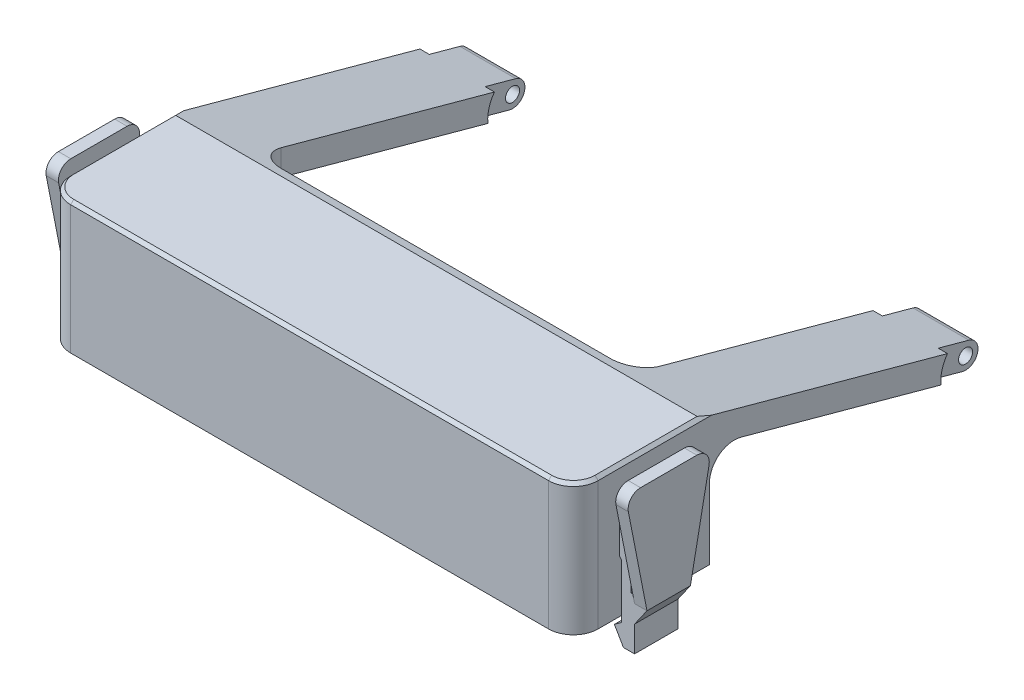
from build123d import *

# Parameters (mm, degrees)
BOSS_EXTRUDE6_DEPTH            = 42.5
FILLET3_R                      = 4
BOSS_EXTRUDE7_DEPTH            = 19.200000225
SKETCH16_W                     = 12
SKETCH16_H                     = 56.251708931
BOSS_EXTRUDE8_DEPTH            = 21.200000225
MIRROR10_START                 = -2.25e-07
MIRROR10_DEPTH                 = 21.200000225
MIRROR10_START_2               = 19.2
MIRROR10_2_DEPTH               = 2
SKETCH17_R                     = 1.132230372
CUT_EXTRUDE3_DEPTH             = 109.502203117
CHAMFER1_SIZE                  = 0.5
SKETCH18_R                     = 5.5
CUT_EXTRUDE4_DEPTH             = 1.5
MIRROR12_COPY_1_SKETCH_R       = 5.5
MIRROR12_COPY_1_DEPTH          = 1.5
CUT_EXTRUDE7_REACH             = 100.98
CUT_EXTRUDE7_DIRECTION_2_REACH = 100.98
FILLET4_R                      = 4
SKETCH41_W                     = 5
SKETCH41_H                     = 0.8
BOSS_EXTRUDE20_DEPTH           = 0.6
BOSS_EXTRUDE21_DEPTH           = 3.5
BOSS_EXTRUDE23_DEPTH           = 2
FILLET5_R                      = 0.3
FILLET6_R                      = 0.1


# Read off the part's stored shape, not the designer's step: Mirror10
with BuildPart() as part:
    # Sketch14 → Boss-Extrude6 (new body)
    with BuildSketch(Plane(origin=(0, 0, 0), x_dir=(0, 0, -1), z_dir=(1, 0, 0))):
        Polygon((-7.766164208, -2.25e-07), (-10.966164208, -2.25e-07), (-10.966164208, 21.2), (10.966164208, 21.2), (10.966164208, -2.25e-07), (7.766164208, -2.25e-07), (7.766164208, 19.2), (-7.766164208, 19.2), align=None)
    extrude(amount=BOSS_EXTRUDE6_DEPTH)

    # Fillet3
    fillet3_edges = [part.edges().sort_by_distance(p)[0] for p in [
        (42.5, 10.599999888, 10.966164208),
    ]]
    fillet(fillet3_edges, radius=FILLET3_R)

    # Sketch15 → Boss-Extrude7 (add)
    with BuildSketch(Plane.XZ.offset(-19.2)):
        with BuildLine():
            Line((42.5, 6.966164208), (42.5, -7.766164208))
            Line((42.5, -7.766164208), (40, -7.766164208))
            Line((40, -7.766164208), (40, 6.966164208))
            ThreePointArc((40, 6.966164208), (39.99240423, 7.116927651), (39.969693846, 7.266164208))
            ThreePointArc((39.969693846, 7.266164208), (39.448683298, 8.128059212), (38.5, 8.466164208))
            Line((38.5, 8.466164208), (38.5, 10.966164208))
            ThreePointArc((38.5, 10.966164208), (41.029822128, 10.064550885), (42.419183588, 7.766164208))
            ThreePointArc((42.419183588, 7.766164208), (42.479744612, 7.368200056), (42.5, 6.966164208))
        make_face()
    extrude(amount=BOSS_EXTRUDE7_DEPTH)

    # Sketch16 → Boss-Extrude8 (add)
    with BuildSketch(Plane(origin=(0, 21.2, 0), x_dir=(1, 0, 0), z_dir=(0, 1, 0))):
        with Locations((36.5, 35.892018674)):
            Rectangle(SKETCH16_W, SKETCH16_H)
    extrude(amount=-BOSS_EXTRUDE8_DEPTH)

    # Mirror10 outline → Mirror10 (add)
    with BuildSketch(Plane(origin=(0, 0, 0), x_dir=(1, 0, 0), z_dir=(0, 1, 0)).offset(MIRROR10_START)):
        with BuildLine():
            Line((0, -7.766164208), (-39.768857754, -7.766164208))
            ThreePointArc((-39.768857754, -7.766164208), (-39.941056319, -7.382525451), (-40, -6.966164208))
            Line((-40, -6.966164208), (-40, 7.766164208))
            Line((-40, 7.766164208), (0, 7.766164208))
            Line((0, 7.766164208), (0, 10.966164208))
            Line((0, 10.966164208), (-30.5, 10.966164208))
            Line((-30.5, 10.966164208), (-30.5, 64.017873139))
            Line((-30.5, 64.017873139), (-42.5, 64.017873139))
            Line((-42.5, 64.017873139), (-42.5, -6.966164208))
            ThreePointArc((-42.5, -6.966164208), (-41.328427125, -9.794591333), (-38.5, -10.966164208))
            Line((-38.5, -10.966164208), (0, -10.966164208))
            Line((0, -10.966164208), (0, -7.766164208))
        make_face()
    extrude(amount=MIRROR10_DEPTH)

    # Mirror10 2 outline → Mirror10 2 (add)
    with BuildSketch(Plane(origin=(0, 0, 0), x_dir=(1, 0, 0), z_dir=(0, 1, 0)).offset(MIRROR10_START_2)):
        with BuildLine():
            ThreePointArc((-40, -6.966164208), (-39.941056319, -7.382525451), (-39.768857754, -7.766164208))
            Line((-39.768857754, -7.766164208), (0, -7.766164208))
            Line((0, -7.766164208), (0, 7.766164208))
            Line((0, 7.766164208), (-40, 7.766164208))
            Line((-40, 7.766164208), (-40, -6.966164208))
        make_face()
    extrude(amount=MIRROR10_2_DEPTH)

    # Sketch17 → Cut-Extrude3 (cut, through all)
    with BuildSketch(Plane.ZY.offset(42.5)):
        with Locations((-53.736263186, 6.999999775)):
            Circle(SKETCH17_R)
        with BuildLine():
            Line((-9.466164208, 21.2), (-54.264633471, 8.928943746))
            ThreePointArc((-54.264633471, 8.928943746), (-55.665207156, 6.47162949), (-53.207892901, 5.071055805))
            Line((-53.207892901, 5.071055805), (-16.022904778, 15.256651174))
            ThreePointArc((-16.022904778, 15.256651174), (-12.539949284, 14.578933218), (-10.966164208, 11.398763232))
            Line((-10.966164208, 11.398763232), (-10.966164208, -2.25e-07))
            Line((-10.966164208, -2.25e-07), (-58.949878023, -2.25e-07))
            Line((-58.949878023, -2.25e-07), (-64.017873139, -2.25e-07))
            Line((-64.017873139, -2.25e-07), (-64.017873139, 6.372862294))
            Line((-64.017873139, 6.372862294), (-64.017873139, 21.2))
            Line((-64.017873139, 21.2), (-9.466164208, 21.2))
        make_face()
    extrude(amount=-CUT_EXTRUDE3_DEPTH, mode=Mode.SUBTRACT)

    # Chamfer1
    chamfer1_edges = [part.edges().sort_by_distance(p)[0] for p in [
        (-42.5, 21.2, -1.25),
        (42.5, 21.2, -1.25),
        (19.25, 21.2, 10.966164208),
        (41.328427125, 21.2, 9.794591333),
        (-41.328427125, 21.2, 9.794591333),
    ]]
    chamfer(chamfer1_edges, length=CHAMFER1_SIZE)

    # Sketch18 → Cut-Extrude4 (cut)
    with BuildSketch(Plane.ZY.offset(42.5)):
        with Locations((-53.736263186, 6.999999775)):
            Circle(SKETCH18_R)
    cut_extrude4 = extrude(amount=-CUT_EXTRUDE4_DEPTH, mode=Mode.SUBTRACT)

    # Mirror11: Cut-Extrude4 across plane
    add(cut_extrude4.mirror(Plane.ZY.offset(36.5)), mode=Mode.SUBTRACT)

    # Mirror12: Cut-Extrude4 across plane
    add(cut_extrude4.mirror(Plane(origin=(0, 0, 0), x_dir=(0, 0, 1), z_dir=(1, 0, 0))), mode=Mode.SUBTRACT)

    # Mirror12 copy 1 sketch → Mirror12 copy 1 (cut)
    with BuildSketch(Plane.ZY.offset(-30.5)):
        with Locations((-53.736263186, 6.999999775)):
            Circle(MIRROR12_COPY_1_SKETCH_R)
    extrude(amount=-MIRROR12_COPY_1_DEPTH, mode=Mode.SUBTRACT)

    # Cut-Extrude7: up to this face of the body (flat: up to its plane)
    cut_extrude7_end = Plane(part.part.faces().sort_by_distance((-40, 9.599999887, -0.4))[0])
    # Sketch23 → Cut-Extrude7 (cut, up to the picked face)
    with BuildSketch(Plane.ZY.offset(36.5), mode=Mode.PRIVATE) as cut_extrude7_sk1:
        with BuildLine():
            Line((-16.287089921, 16.221123159), (-45.347315212, 8.261037353))
            ThreePointArc((-45.347315212, 8.261037353), (-45.878172566, 7.903119099), (-46.083130069, 7.296565368))
            Line((-46.083130069, 7.296565368), (-46.083130069, 7.022648503))
            Line((-46.083130069, 7.022648503), (-47.68348017, 6.584285621))
            Line((-47.68348017, 6.584285621), (-47.68348017, 7.406036215))
            ThreePointArc((-47.68348017, 7.406036215), (-47.068607659, 9.225697409), (-45.476035597, 10.299452171))
            Line((-45.476035597, 10.299452171), (-11.027350425, 19.735528015))
            Line((-11.027350425, 19.735528015), (-7.766164208, 19.2))
            Line((-7.766164208, 19.2), (-7.766164208, 13.2))
            Line((-7.766164208, 13.2), (-10.301880115, 13.2))
            ThreePointArc((-10.301880115, 13.2), (-12.713097942, 15.862359585), (-16.287089921, 16.221123159))
        make_face()
    cut_extrude7_tool1 = split(extrude(cut_extrude7_sk1.sketch, amount=CUT_EXTRUDE7_REACH, mode=Mode.PRIVATE), bisect_by=cut_extrude7_end, keep=Keep.BOTH, mode=Mode.PRIVATE)
    add(cut_extrude7_tool1.solids().sort_by(Axis((-36.5, 14.283351, -24.707146), (-1, 0, 0)))[0], mode=Mode.SUBTRACT)

    # Cut-Extrude7 direction 2: up to this face of the body (flat: up to its plane)
    cut_extrude7_direction_2_end = Plane(part.part.faces().sort_by_distance((-32, 7.583720498, -51.605249006))[0])
    # Sketch23 → Cut-Extrude7 direction 2 (cut, up to the picked face)
    with BuildSketch(Plane.ZY.offset(36.5), mode=Mode.PRIVATE) as cut_extrude7_direction_2_sk1:
        with BuildLine():
            Line((-16.287089921, 16.221123159), (-45.347315212, 8.261037353))
            ThreePointArc((-45.347315212, 8.261037353), (-45.878172566, 7.903119099), (-46.083130069, 7.296565368))
            Line((-46.083130069, 7.296565368), (-46.083130069, 7.022648503))
            Line((-46.083130069, 7.022648503), (-47.68348017, 6.584285621))
            Line((-47.68348017, 6.584285621), (-47.68348017, 7.406036215))
            ThreePointArc((-47.68348017, 7.406036215), (-47.068607659, 9.225697409), (-45.476035597, 10.299452171))
            Line((-45.476035597, 10.299452171), (-11.027350425, 19.735528015))
            Line((-11.027350425, 19.735528015), (-7.766164208, 19.2))
            Line((-7.766164208, 19.2), (-7.766164208, 13.2))
            Line((-7.766164208, 13.2), (-10.301880115, 13.2))
            ThreePointArc((-10.301880115, 13.2), (-12.713097942, 15.862359585), (-16.287089921, 16.221123159))
        make_face()
    cut_extrude7_direction_2_tool1 = split(extrude(cut_extrude7_direction_2_sk1.sketch, amount=-CUT_EXTRUDE7_DIRECTION_2_REACH, mode=Mode.PRIVATE), bisect_by=cut_extrude7_direction_2_end, keep=Keep.BOTH, mode=Mode.PRIVATE)
    add(cut_extrude7_direction_2_tool1.solids().sort_by(Axis((-36.5, 14.283351, -24.707146), (1, 0, 0)))[0], mode=Mode.SUBTRACT)

    # Fillet4
    fillet4_edges = [part.edges().sort_by_distance(p)[0] for p in [
        (-30.5, 16.093943968, -10.966164208),
        (30.5, 16.093943967, -10.966164208),
    ]]
    fillet(fillet4_edges, radius=FILLET4_R)

    # Sketch41 → Boss-Extrude20 (add)
    with BuildSketch(Plane.XZ):
        Polygon((-40, -5.266164208), (-35, -6.966164208), (-35, -7.766164208), (-40, -7.766164208), align=None)
        Polygon((35, -6.966164208), (35, -7.766164208), (40, -7.766164208), (40, -5.266164208), align=None)
        with Locations((-37.5, 7.366164208)):
            Rectangle(SKETCH41_W, SKETCH41_H)
        with Locations((37.5, 7.366164208)):
            Rectangle(SKETCH41_W, SKETCH41_H)
    extrude(amount=-BOSS_EXTRUDE20_DEPTH)

    # Sketch42 → Boss-Extrude21 (add, symmetric)
    with BuildSketch(Plane.XY):
        Polygon((-44.9, 0.143703762), (-44.9, -4.017561374), (-43.1, -4.017561374), (-41.65, -1.517561374), (-42.8, -0.682037466), (-42.8, 7.995486209), (-42.5, 8.363098451), (-42.5, 13.2), (-44.3, 7.840797374), (-44.3, 4.199999775), (-44.9, 4.199999775), (-44.9, 2.999999775), (-46.9, 2.999999775), align=None)
    boss_extrude21 = extrude(amount=BOSS_EXTRUDE21_DEPTH, both=True)

    # Sketch44 → Boss-Extrude23 (add)
    with BuildSketch(Plane.ZY.offset(44.9)):
        with BuildLine():
            Line((-3.5, 2.999999775), (3.5, 2.999999775))
            Line((3.5, 2.999999775), (6.499239291, 18.315643504))
            ThreePointArc((6.499239291, 18.315643504), (6.080655383, 19.971079661), (4.536519218, 20.7))
            Line((4.536519218, 20.7), (-4.536519218, 20.7))
            ThreePointArc((-4.536519218, 20.7), (-6.080655383, 19.971079661), (-6.499239291, 18.315643504))
            Line((-6.499239291, 18.315643504), (-3.5, 2.999999775))
        make_face()
    boss_extrude23 = extrude(amount=BOSS_EXTRUDE23_DEPTH)

    # Mirror13: Boss-Extrude21, Boss-Extrude23 across plane
    add(boss_extrude21.mirror(Plane(origin=(0, 0, 0), x_dir=(0, 0, 1), z_dir=(1, 0, 0))))
    add(boss_extrude23.mirror(Plane(origin=(0, 0, 0), x_dir=(0, 0, 1), z_dir=(1, 0, 0))))

    # Fillet5
    fillet5_edges = [part.edges().sort_by_distance(p)[0] for p in [
        (-44.9, 4.199999775, 0),
        (-44.3, 4.199999775, 0),
    ]]
    fillet(fillet5_edges, radius=FILLET5_R - 0.0001)  # a hair under: the kernel refuses the full size

    # Fillet6
    fillet6_edges = [part.edges().sort_by_distance(p)[0] for p in [
        (-42.5, 8.363098451, 0),
    ]]
    fillet(fillet6_edges, radius=FILLET6_R)


solid = part.part
